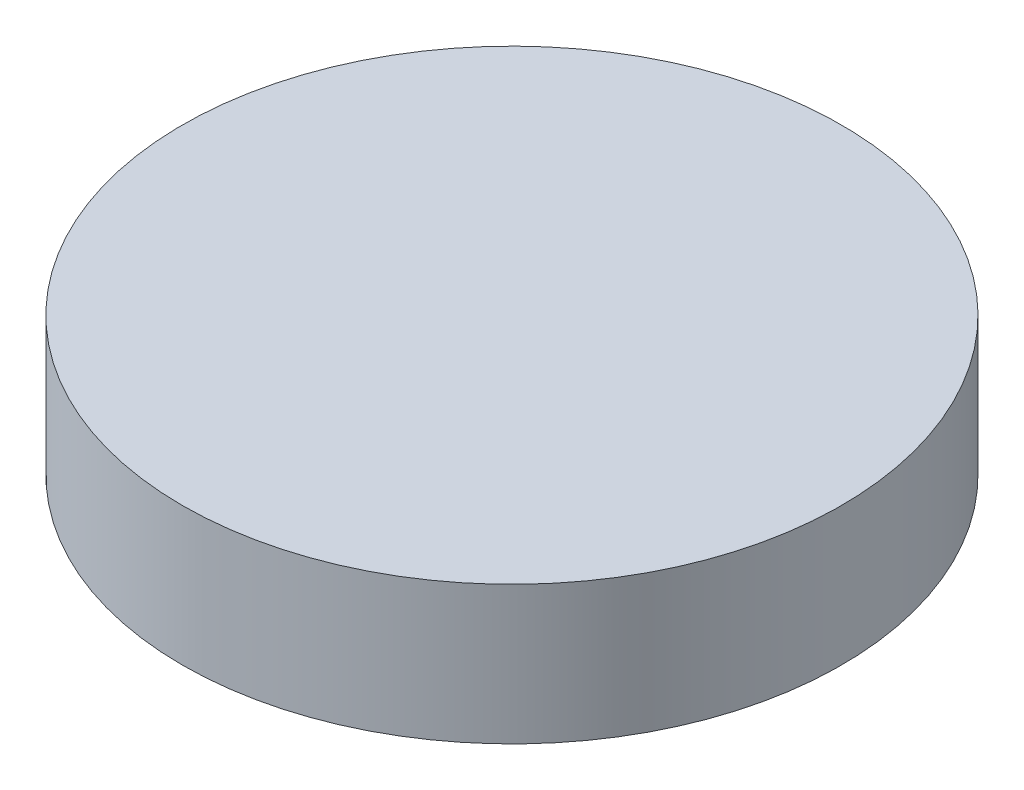
from build123d import *

# Parameters (mm, degrees)
SKETCH1_R           = 76.29
BOSS_EXTRUDE1_DEPTH = 32


with BuildPart() as part:
    # Sketch1 → Boss-Extrude1 (new body)
    with BuildSketch(Plane(origin=(0, 0, 0), x_dir=(1, 0, 0), z_dir=(0, 1, 0))):
        Circle(SKETCH1_R)
    extrude(amount=BOSS_EXTRUDE1_DEPTH)


solid = part.part
